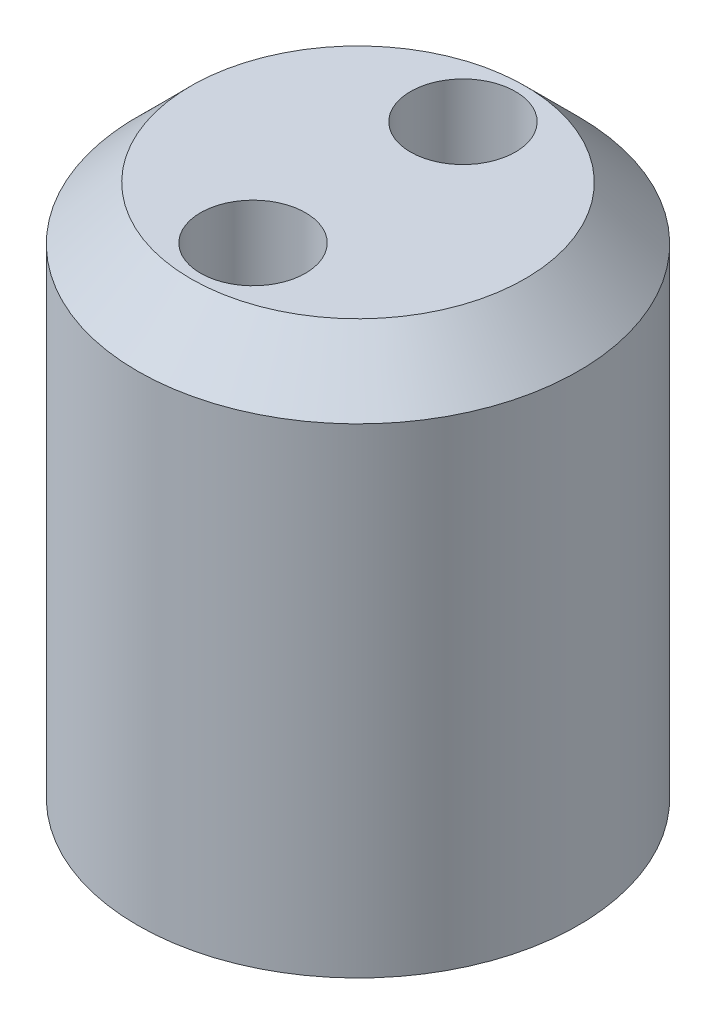
from build123d import *

# Parameters (mm, degrees)
SKETCH1_R           = 10.499999955
SKETCH1_R_2         = 2.5
BOSS_EXTRUDE1_DEPTH = 25.4
CHAMFER1_SIZE       = 2.54


with BuildPart() as part:
    # Sketch1 → Boss-Extrude1 (new body)
    with BuildSketch(Plane(origin=(0, 0, 0), x_dir=(1, 0, 0), z_dir=(0, 1, 0))):
        Circle(SKETCH1_R)
        with Locations((0, 5)):
            Circle(SKETCH1_R_2, mode=Mode.SUBTRACT)
        with Locations((0, -5)):
            Circle(SKETCH1_R_2, mode=Mode.SUBTRACT)
    extrude(amount=BOSS_EXTRUDE1_DEPTH)

    # Chamfer1
    chamfer1_edges = [part.edges().sort_by_distance(p)[0] for p in [
        (-10.499999955, 25.4, 0),
    ]]
    chamfer(chamfer1_edges, length=CHAMFER1_SIZE)


solid = part.part
